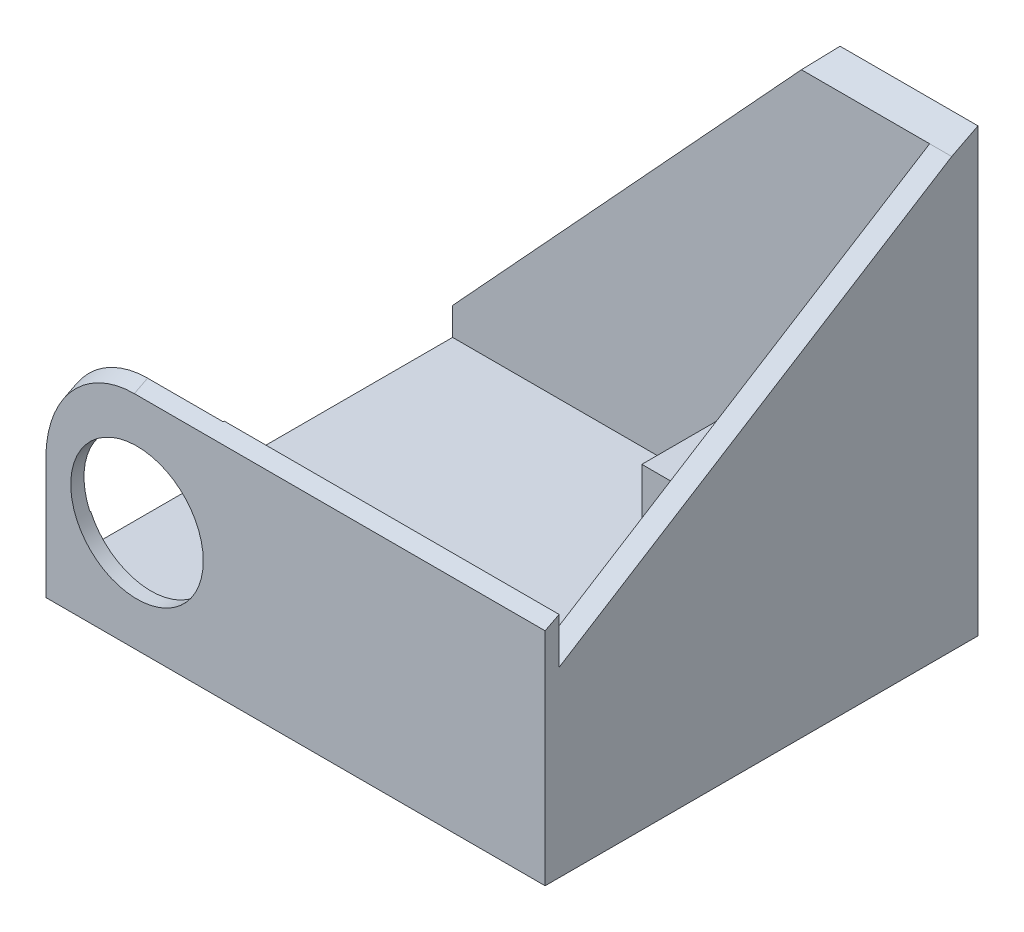
from build123d import *

# Parameters (mm, degrees)
SKETCH1_W           = 113
SKETCH1_H           = 98
BOSS_EXTRUDE1_DEPTH = 100
CUT_EXTRUDE1_DEPTH  = 130
CUT_EXTRUDE3_DEPTH  = 95
SKETCH4_W           = 113
SKETCH4_H           = 88.876192891
CUT_EXTRUDE4_DEPTH  = 95
BOSS_EXTRUDE4_DEPTH = 5
SKETCH7_W           = 36.687301185
SKETCH7_H           = 28.468155535
BOSS_EXTRUDE6_DEPTH = 25
SKETCH8_R           = 15
CUT_EXTRUDE5_DEPTH  = 25
FILLET1_R           = 20


with BuildPart() as part:
    # Sketch1 → Boss-Extrude1 (new body)
    with BuildSketch(Plane(origin=(0, 0, 0), x_dir=(1, 0, 0), z_dir=(0, 1, 0))):
        with Locations((9.126923077, -28.796153846)):
            Rectangle(SKETCH1_W, SKETCH1_H)
    extrude(amount=-BOSS_EXTRUDE1_DEPTH)

    # Sketch2 → Cut-Extrude1 (cut)
    with BuildSketch(Plane(origin=(65.626923077, 0, 0), x_dir=(0, 0, -1), z_dir=(1, 0, 0))):
        Polygon((20.203846154, 0), (-77.796153846, -50), (-77.796153846, 0), align=None)
    extrude(amount=-CUT_EXTRUDE1_DEPTH, mode=Mode.SUBTRACT)

    # Sketch3 → Cut-Extrude3 (cut)
    with BuildSketch(Plane(origin=(0, 0, -20.203846154), x_dir=(-1, 0, 0), z_dir=(0, 0, -1))):
        Polygon((-34.397311681, 0), (47.373076923, -88.732184402), (47.373076923, 0), align=None)
    extrude(amount=-CUT_EXTRUDE3_DEPTH, mode=Mode.SUBTRACT)

    # Sketch4 → Cut-Extrude4 (cut)
    with BuildSketch(Plane(origin=(0, 0, 0), x_dir=(1, 0, 0), z_dir=(0, 1, 0))):
        with Locations((9.126923077, -30.184844361)):
            Rectangle(SKETCH4_W, SKETCH4_H)
    extrude(amount=-CUT_EXTRUDE4_DEPTH, mode=Mode.SUBTRACT)

    # Sketch6 → Boss-Extrude4 (add)
    with BuildSketch(Plane(origin=(65.626923077, 0, 0), x_dir=(0, 0, -1), z_dir=(1, 0, 0))):
        Polygon((14.253252085, -95), (14.253252085, -3.036017382), (-74.622940806, -58.738358676), (-74.622940806, -95), align=None)
    extrude(amount=-BOSS_EXTRUDE4_DEPTH)

    # Sketch7 → Boss-Extrude6 (add)
    with BuildSketch(Plane(origin=(0, -95, 0), x_dir=(1, 0, 0), z_dir=(0, 1, 0))):
        with Locations((42.283272485, 0.019174318)):
            Rectangle(SKETCH7_W, SKETCH7_H)
    extrude(amount=BOSS_EXTRUDE6_DEPTH)

    # Sketch8 → Cut-Extrude5 (cut)
    with BuildSketch(Plane.XY.offset(77.796153846)):
        with Locations((-26.771199052, -75)):
            Circle(SKETCH8_R)
    extrude(amount=-CUT_EXTRUDE5_DEPTH, mode=Mode.SUBTRACT)

    # Fillet1
    # the kernel refuses this fillet: 20 mm, written as the material it takes off along each edge
    with BuildSketch(Plane(origin=(-47.373076923, -25.745870671, 30.258060361), x_dir=(0, -0.8907618697082329, -0.454470341687874), z_dir=(0, -0.45447034168787404, 0.890761869708233))) as fillet1_piece_1:
        with BuildLine():
            CenterArc((FILLET1_R, FILLET1_R), FILLET1_R, 180, 90)
            Line((0, FILLET1_R), (0, 0))
            Line((0, 0), (FILLET1_R, 0))
        make_face()
    extrude(amount=103.367903479, mode=Mode.SUBTRACT)


solid = part.part
